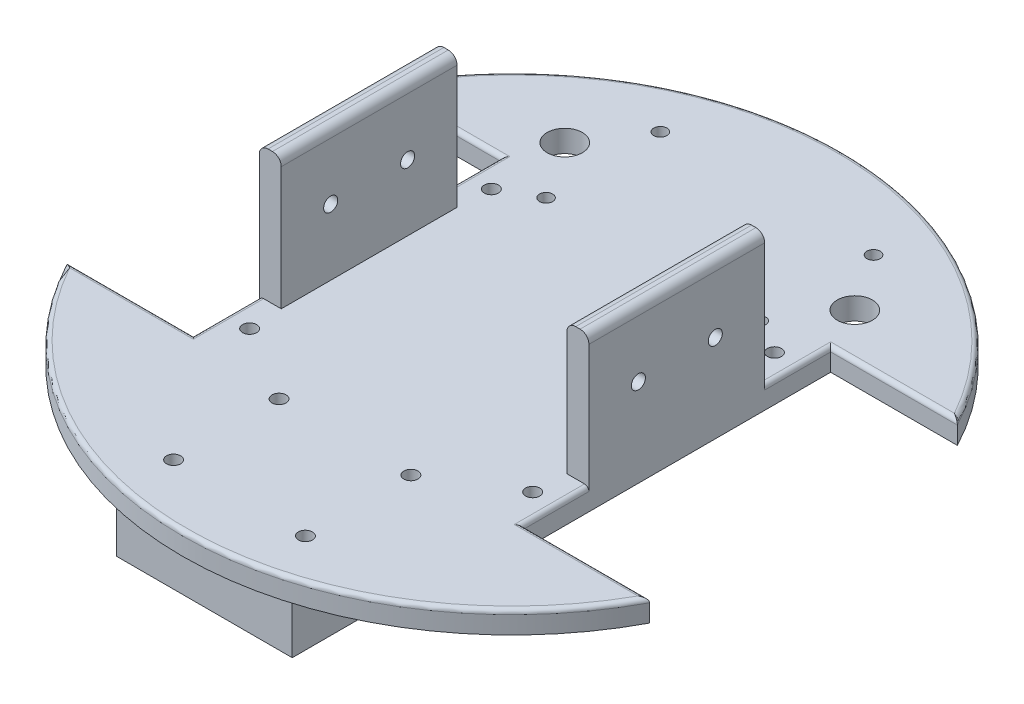
from build123d import *

# Parameters (mm, degrees)
SKETCH1_R           = 75
BOSS_EXTRUDE2_DEPTH = 5
SKETCH5_W           = 35
SKETCH5_H           = 70
CUT_EXTRUDE1_DEPTH  = 107.183802908
SKETCH6_W           = 5
SKETCH6_H           = 40
BOSS_EXTRUDE3_DEPTH = 30
SKETCH7_R           = 1.6
CUT_EXTRUDE2_DEPTH  = 136.669635512
SKETCH8_W           = 40
SKETCH8_H           = 40
BOSS_EXTRUDE5_DEPTH = 12.5
SKETCH9_R           = 1.6
CUT_EXTRUDE3_DEPTH  = 111.820801297
SKETCH10_R          = 1.6
SKETCH10_R_2        = 4
CUT_EXTRUDE8_DEPTH  = 105.522724802
SKETCH13_R          = 1.5
CUT_EXTRUDE9_DEPTH  = 105.522724802
FILLET1_R           = 1
FILLET2_R           = 2


with BuildPart() as part:
    # Sketch1 → Boss-Extrude2 (new body)
    with BuildSketch(Plane(origin=(0, 0, 0), x_dir=(1, 0, 0), z_dir=(0, 1, 0))):
        Circle(SKETCH1_R)
    extrude(amount=BOSS_EXTRUDE2_DEPTH)

    # Sketch5 → Cut-Extrude1 (cut, through all)
    with BuildSketch(Plane(origin=(0, 5, 0), x_dir=(1, 0, 0), z_dir=(0, 1, 0))):
        with Locations((55, 0)):
            Rectangle(SKETCH5_W, SKETCH5_H)
        with Locations((-55, 0)):
            Rectangle(SKETCH5_W, SKETCH5_H)
    extrude(amount=-CUT_EXTRUDE1_DEPTH, mode=Mode.SUBTRACT)


with BuildPart() as cut_extrude1_piece_1:
    # of the separate pieces the step leaves, piece 1, a body of its own (cut_extrude1_pieces)
    add(part.part.solids().sort_by_distance((66.332495807, 0, -35))[0])

    # Sketch6 → Boss-Extrude3 (add)
    with BuildSketch(Plane(origin=(0, 5, 0), x_dir=(1, 0, 0), z_dir=(0, 1, 0))):
        with Locations((-35, 0)):
            Rectangle(SKETCH6_W, SKETCH6_H)
    boss_extrude3 = extrude(amount=BOSS_EXTRUDE3_DEPTH)

    # Sketch7 → Cut-Extrude2 (cut, through all)
    with BuildSketch(Plane(origin=(-32.5, 0, 0), x_dir=(0, 0, -1), z_dir=(1, 0, 0))):
        with Locations((-8.75, 20)):
            Circle(SKETCH7_R)
        with Locations((8.75, 20)):
            Circle(SKETCH7_R)
    cut_extrude2 = extrude(amount=-CUT_EXTRUDE2_DEPTH, mode=Mode.SUBTRACT)

    # Mirror1: Boss-Extrude3, Cut-Extrude2 across plane
    add(boss_extrude3.mirror(Plane(origin=(0, 0, 0), x_dir=(0, 0, 1), z_dir=(1, 0, 0))))
    add(cut_extrude2.mirror(Plane(origin=(0, 0, 0), x_dir=(0, 0, 1), z_dir=(1, 0, 0))), mode=Mode.SUBTRACT)

    # Sketch8 → Boss-Extrude5 (add)
    with BuildSketch(Plane.XZ):
        with Locations((0, 50)):
            Rectangle(SKETCH8_W, SKETCH8_H)
    extrude(amount=BOSS_EXTRUDE5_DEPTH)

    # Sketch9 → Cut-Extrude3 (cut, through all)
    with BuildSketch(Plane.XZ.offset(12.5)):
        with Locations((-15, 62)):
            Circle(SKETCH9_R)
        with Locations((15, 62)):
            Circle(SKETCH9_R)
        with Locations((-15, 38)):
            Circle(SKETCH9_R)
        with Locations((15, 38)):
            Circle(SKETCH9_R)
    extrude(amount=-CUT_EXTRUDE3_DEPTH, mode=Mode.SUBTRACT)

    # Sketch10 → Cut-Extrude8 (cut, through all)
    with BuildSketch(Plane(origin=(0, 5, 0), x_dir=(1, 0, 0), z_dir=(0, 1, 0))):
        with Locations((32.2, 27.5)):
            Circle(SKETCH10_R)
        with Locations((-32.2, 27.5)):
            Circle(SKETCH10_R)
        with Locations((-32.2, -27.5)):
            Circle(SKETCH10_R)
        with Locations((32.2, -27.5)):
            Circle(SKETCH10_R)
        with Locations((-33, 45)):
            Circle(SKETCH10_R_2)
        with Locations((33, 45)):
            Circle(SKETCH10_R_2)
    extrude(amount=-CUT_EXTRUDE8_DEPTH, mode=Mode.SUBTRACT)

    # Sketch13 → Cut-Extrude9 (cut, through all)
    with BuildSketch(Plane(origin=(0, 5, 0), x_dir=(1, 0, 0), z_dir=(0, 1, 0))):
        with Locations((24.25, 58)):
            Circle(SKETCH13_R)
        with Locations((-24.25, 58)):
            Circle(SKETCH13_R)
        with Locations((-24.25, 32)):
            Circle(SKETCH13_R)
        with Locations((24.25, 32)):
            Circle(SKETCH13_R)
    extrude(amount=-CUT_EXTRUDE9_DEPTH, mode=Mode.SUBTRACT)

    # Fillet1
    fillet1_edges = [cut_extrude1_piece_1.edges().sort_by_distance(p)[0] for p in [
        (51.916247904, 5, -35),
        (37.5, 5, -27.5),
        (37.5, 5, 27.5),
        (51.916247904, 5, 35),
        (0, 5, 75),
        (-51.916247904, 5, 35),
        (-37.5, 5, 27.5),
        (-37.5, 5, -27.5),
        (-51.916247904, 5, -35),
        (0, 5, -75),
    ]]
    fillet(fillet1_edges, radius=FILLET1_R)

    # Fillet2
    fillet2_edges = [cut_extrude1_piece_1.edges().sort_by_distance(p)[0] for p in [
        (37.5, 35, 0),
        (32.5, 35, 0),
        (-37.5, 35, 0),
        (-32.5, 35, 0),
    ]]
    fillet(fillet2_edges, radius=FILLET2_R)


with BuildPart() as cut_extrude1_piece_2:
    # of the separate pieces the step leaves, piece 2, a body of its own (cut_extrude1_pieces)
    add(part.part.solids().sort_by_distance((72.5, 0, 19.20286437))[0])


with BuildPart() as cut_extrude1_piece_3:
    # of the separate pieces the step leaves, piece 3, a body of its own (cut_extrude1_pieces)
    add(part.part.solids().sort_by_distance((-72.5, 0, -19.20286437))[0])


solid = cut_extrude1_piece_1.part
